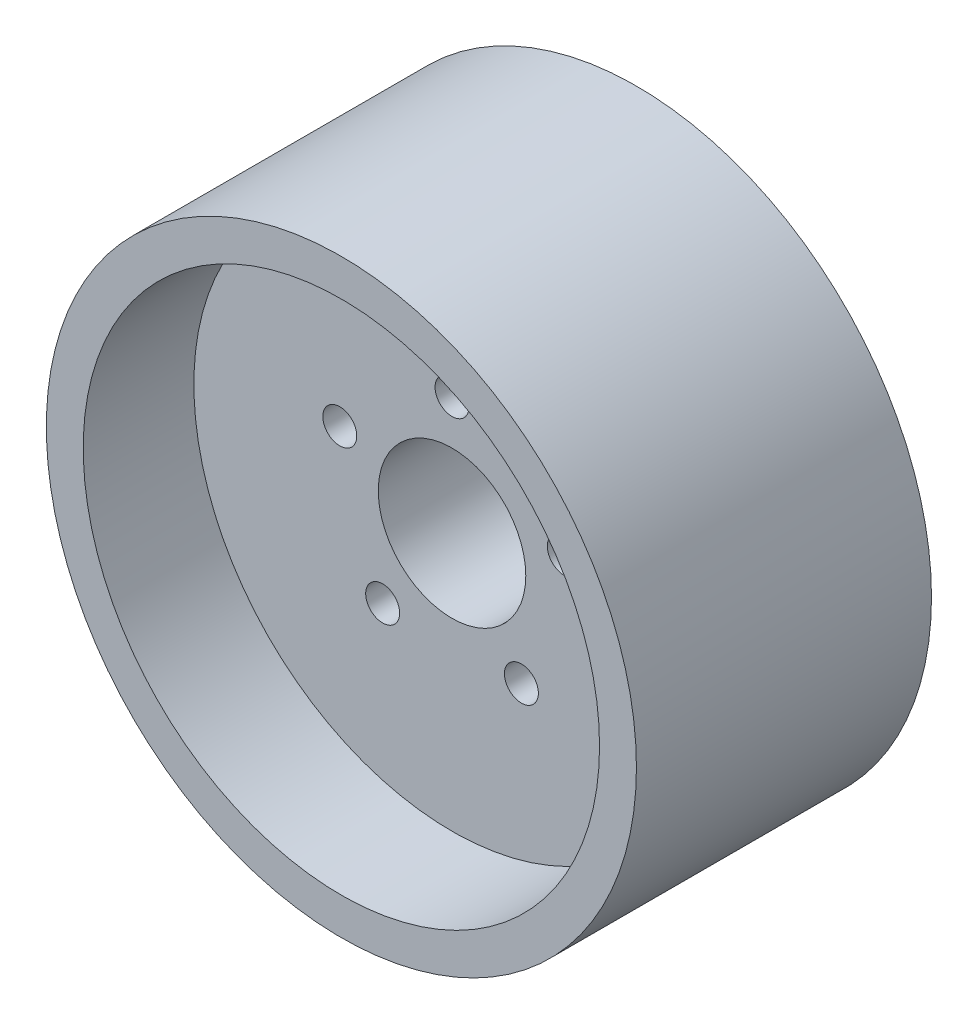
from build123d import *

# Parameters (mm, degrees)
BOSS_EXTRUDE2_DEPTH      = 25.4
BOSS_EXTRUDE2_DEPTH_BACK = 25.4
SKETCH1_R                = 50.8
SKETCH1_R_2              = 12.7
SKETCH1_R_3              = 2.921
SKETCH2_R                = 44.45
CUT_EXTRUDE1_DEPTH       = 19.05


with BuildPart() as part:
    # Sketch1 → Boss-Extrude2 (new, two sides: drawn at the far end of the back side and taken through both)
    with BuildSketch(Plane.XY.offset(-BOSS_EXTRUDE2_DEPTH_BACK)):
        Circle(SKETCH1_R)
        Circle(SKETCH1_R_2, mode=Mode.SUBTRACT)
        with Locations((0, 20.32)):
            Circle(SKETCH1_R_3, mode=Mode.SUBTRACT)
        with Locations((19.325468411, 6.279225326)):
            Circle(SKETCH1_R_3, mode=Mode.SUBTRACT)
        with Locations((11.943796327, -16.439225326)):
            Circle(SKETCH1_R_3, mode=Mode.SUBTRACT)
        with Locations((-11.943796327, -16.439225326)):
            Circle(SKETCH1_R_3, mode=Mode.SUBTRACT)
        with Locations((-19.325468411, 6.279225326)):
            Circle(SKETCH1_R_3, mode=Mode.SUBTRACT)
    extrude(amount=BOSS_EXTRUDE2_DEPTH + BOSS_EXTRUDE2_DEPTH_BACK)

    # Sketch2 → Cut-Extrude1 (cut)
    with BuildSketch(Plane.XY.offset(25.4)):
        Circle(SKETCH2_R)
    extrude(amount=-CUT_EXTRUDE1_DEPTH, mode=Mode.SUBTRACT)


solid = part.part
